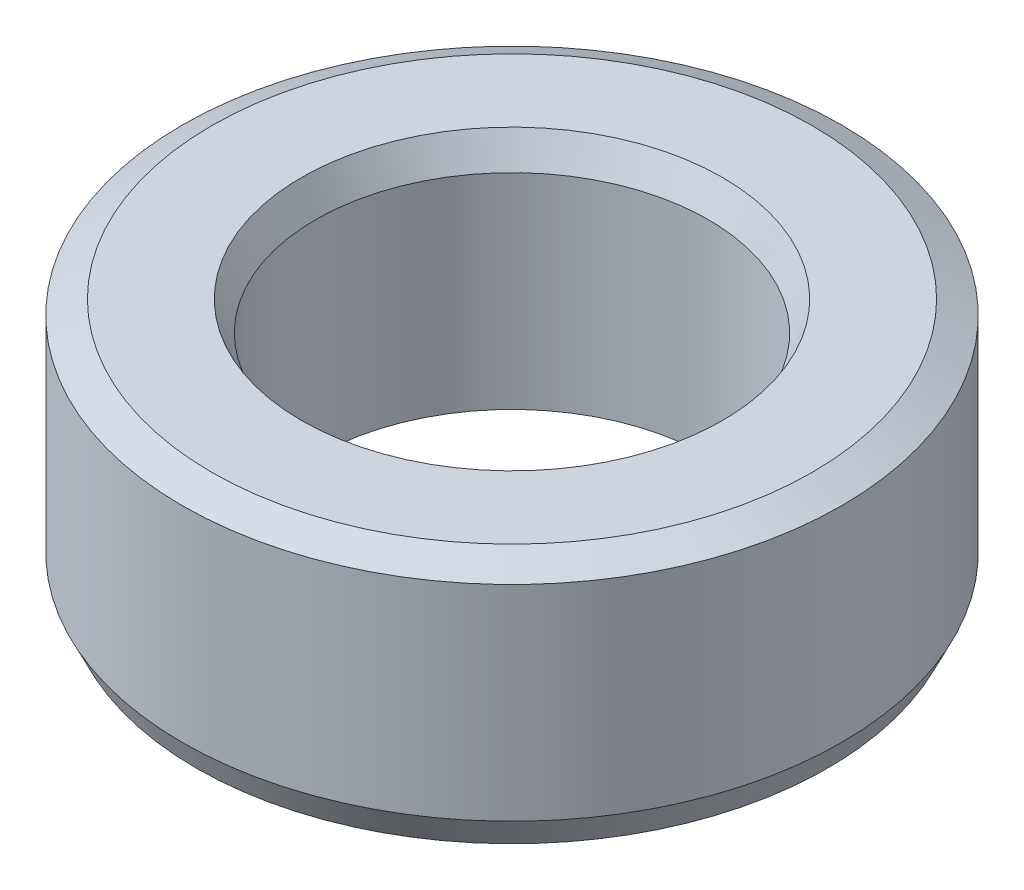
from build123d import *
from OCP.BRepFilletAPI import BRepFilletAPI_MakeChamfer

# Parameters (mm, degrees)
SKETCH1_R           = 50
BOSS_EXTRUDE1_DEPTH = 37.709896149
SKETCH2_R           = 29.779803363
CUT_EXTRUDE1_DEPTH  = 81.137608322
CHAMFER1_SIZE       = 2.146376531
CHAMFER1_SIZE2      = 4.465776031


with BuildPart() as part:
    # Sketch1 → Boss-Extrude1 (new body)
    with BuildSketch(Plane(origin=(0, 0, 0), x_dir=(1, 0, 0), z_dir=(0, 1, 0))):
        Circle(SKETCH1_R)
    extrude(amount=BOSS_EXTRUDE1_DEPTH)

    # Sketch2 → Cut-Extrude1 (cut, through all)
    with BuildSketch(Plane(origin=(0, 0, 0), x_dir=(1, 0, 0), z_dir=(0, 1, 0))):
        Circle(SKETCH2_R)
    extrude(amount=CUT_EXTRUDE1_DEPTH, mode=Mode.SUBTRACT)

    # Chamfer1: one chamfer whose edges measure the first distance from different faces: ONE call of the kernel's chamfer builder (chamfer() names one face for all edges)
    chamfer1_edges_1 = [part.edges().sort_by_distance(p)[0] for p in [
        (-29.779803363, 37.709896149, 0),
    ]]
    chamfer1_side_1 = [part.faces().sort_by_distance(p)[0] for p in [
        (-48.585786438, 37.709896149, 0),
    ]]
    chamfer1_edges_2 = [part.edges().sort_by_distance(p)[0] for p in [
        (-29.779803363, 0, 0),
    ]]
    chamfer1_side_2 = [part.faces().sort_by_distance(p)[0] for p in [
        (-29.779803363, 18.854948075, 0),
    ]]
    chamfer1_edges_3 = [part.edges().sort_by_distance(p)[0] for p in [
        (-50, 0, 0),
    ]]
    chamfer1_side_3 = [part.faces().sort_by_distance(p)[0] for p in [
        (-48.585786438, 0, 0),
    ]]
    chamfer1_edges_4 = [part.edges().sort_by_distance(p)[0] for p in [
        (-50, 37.709896149, 0),
    ]]
    chamfer1_side_4 = [part.faces().sort_by_distance(p)[0] for p in [
        (-50, 18.854948075, 0),
    ]]
    chamfer1 = BRepFilletAPI_MakeChamfer(part.part.solid().wrapped)
    for e in chamfer1_edges_1:
        chamfer1.Add(CHAMFER1_SIZE, CHAMFER1_SIZE2, e.wrapped, chamfer1_side_1[0].wrapped)  # the first distance lies on this face
    for e in chamfer1_edges_2:
        chamfer1.Add(CHAMFER1_SIZE, CHAMFER1_SIZE2, e.wrapped, chamfer1_side_2[0].wrapped)  # the first distance lies on this face
    for e in chamfer1_edges_3:
        chamfer1.Add(CHAMFER1_SIZE, CHAMFER1_SIZE2, e.wrapped, chamfer1_side_3[0].wrapped)  # the first distance lies on this face
    for e in chamfer1_edges_4:
        chamfer1.Add(CHAMFER1_SIZE, CHAMFER1_SIZE2, e.wrapped, chamfer1_side_4[0].wrapped)  # the first distance lies on this face
    add(Compound.cast(chamfer1.Shape()), mode=Mode.REPLACE)


solid = part.part
